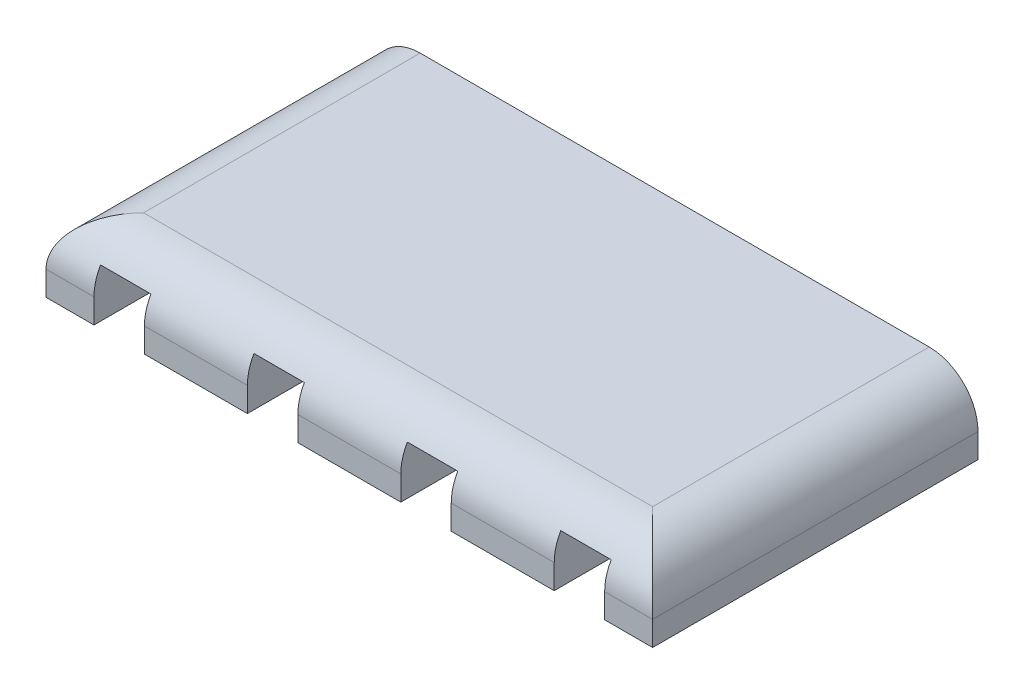
from build123d import *

# Parameters (mm, degrees)
SKETCH1_W               = 37.29
SKETCH1_H               = 4.5
BOSS_EXTRUDE1_DEPTH     = 20
CUT_EXTRUDE1_DEPTH      = 43.553426419
CUT_EXTRUDE1_DEPTH_BACK = 43.553426419
SKETCH1_3_W             = 3.1
SKETCH1_3_H             = 3
CUT_EXTRUDE2_START      = 9
SKETCH1_4_W             = 4.85
SKETCH1_4_H             = 3
CUT_EXTRUDE2_DEPTH      = 5.5
SKETCH1_5_W             = 5
SKETCH1_5_H             = 3.5
CUT_EXTRUDE3_DEPTH      = 2.5
FILLET1_R               = 3


with BuildPart() as part:
    # Sketch1 → Boss-Extrude1 (new body)
    with BuildSketch(Plane.XY):
        with Locations((18.645, 2.25)):
            Rectangle(SKETCH1_W, SKETCH1_H)
    extrude(amount=BOSS_EXTRUDE1_DEPTH)

    # Sketch1<3> → Cut-Extrude1 (cut, two sides: drawn at the far end of the back side and taken through both)
    with BuildSketch(Plane.XY.offset(-CUT_EXTRUDE1_DEPTH_BACK)):
        with Locations((4.5, 1.5)):
            Rectangle(SKETCH1_3_W, SKETCH1_3_H)
        with Locations((13.93, 1.5)):
            Rectangle(SKETCH1_3_W, SKETCH1_3_H)
        with Locations((23.36, 1.5)):
            Rectangle(SKETCH1_3_W, SKETCH1_3_H)
        with Locations((32.79, 1.5)):
            Rectangle(SKETCH1_3_W, SKETCH1_3_H)
    extrude(amount=CUT_EXTRUDE1_DEPTH + CUT_EXTRUDE1_DEPTH_BACK, mode=Mode.SUBTRACT)

    # Sketch1<4> → Cut-Extrude2 (cut)
    with BuildSketch(Plane.XY.offset(CUT_EXTRUDE2_START)):
        with Locations((4.5, 1.5)):
            Rectangle(SKETCH1_4_W, SKETCH1_4_H)
        with Locations((13.93, 1.5)):
            Rectangle(SKETCH1_4_W, SKETCH1_4_H)
        with Locations((23.36, 1.5)):
            Rectangle(SKETCH1_4_W, SKETCH1_4_H)
        with Locations((32.79, 1.5)):
            Rectangle(SKETCH1_4_W, SKETCH1_4_H)
    extrude(amount=CUT_EXTRUDE2_DEPTH, mode=Mode.SUBTRACT)

    # Sketch1<5> → Cut-Extrude3 (cut)
    with BuildSketch(Plane.XY):
        with Locations((4.5, 1.75)):
            Rectangle(SKETCH1_5_W, SKETCH1_5_H)
        with Locations((13.93, 1.75)):
            Rectangle(SKETCH1_5_W, SKETCH1_5_H)
        with Locations((23.36, 1.75)):
            Rectangle(SKETCH1_5_W, SKETCH1_5_H)
        with Locations((32.79, 1.75)):
            Rectangle(SKETCH1_5_W, SKETCH1_5_H)
    extrude(amount=CUT_EXTRUDE3_DEPTH, mode=Mode.SUBTRACT)

    # Fillet1
    # the kernel refuses this fillet: 3 mm, written as the material it takes off along each edge
    with BuildSketch(Plane(origin=(-7.5, 4.5, 20), x_dir=(0, 0, -1), z_dir=(1, 0, 0))) as fillet1_piece_1:
        with BuildLine():
            CenterArc((FILLET1_R, -FILLET1_R), FILLET1_R, 90, 90)
            Line((0, -FILLET1_R), (0, 0))
            Line((0, 0), (FILLET1_R, 0))
        make_face()
    extrude(amount=52.29, mode=Mode.SUBTRACT)
    with BuildSketch(Plane(origin=(37.29, 4.5, -7.5), x_dir=(-1, 0, 0), z_dir=(0, 0, 1)), Plane(origin=(0, 4.5, -7.5), x_dir=(0, -1, 0), z_dir=(0, 0, 1))) as fillet1_piece_2:
        with BuildLine():
            CenterArc((FILLET1_R, FILLET1_R), FILLET1_R, 180, 90)
            Line((0, FILLET1_R), (0, 0))
            Line((0, 0), (FILLET1_R, 0))
        make_face()
    extrude(amount=35, mode=Mode.SUBTRACT)


solid = part.part
